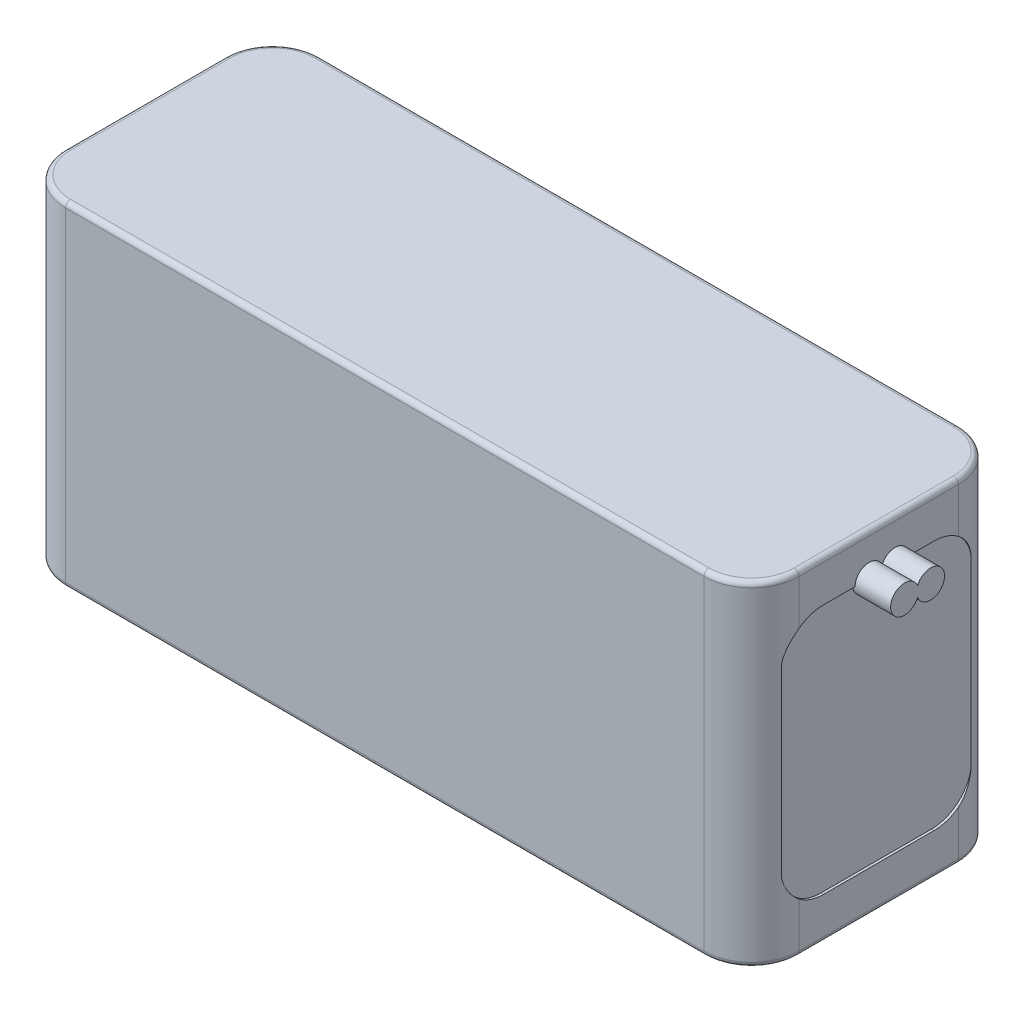
from build123d import *

# Parameters (mm, degrees)
SKETCH1_W                = 147
SKETCH1_H                = 67.000000112
BOSS_EXTRUDE1_DEPTH      = 51
CUT_EXTRUDE1_DEPTH       = 0.5
CUT_EXTRUDE2_DEPTH       = 0.5
FILLET1_R                = 9.525
FILLET2_R                = 1
BOSS_EXTRUDE2_DEPTH      = 7.62
BOSS_EXTRUDE2_DEPTH_BACK = 2.54


with BuildPart() as part:
    # Sketch1 → Boss-Extrude1 (new body)
    with BuildSketch(Plane(origin=(0, 0, -15), x_dir=(-1, 0, 0), z_dir=(0, 0, -1))):
        with Locations((4.5, 11.500000056)):
            Rectangle(SKETCH1_W, SKETCH1_H)
    extrude(amount=-BOSS_EXTRUDE1_DEPTH)

    # Sketch2 → Cut-Extrude1 (cut)
    with BuildSketch(Plane(origin=(69, 0, 0), x_dir=(0, 0, -1), z_dir=(1, 0, 0))):
        with BuildLine():
            Line((-29.625, 28.625000098), (-29.625, -5.624999986))
            ThreePointArc((-29.625, -5.624999986), (-27.281854249, -11.281854235), (-21.625, -13.624999986))
            Line((-21.625, -13.624999986), (0.625, -13.624999986))
            ThreePointArc((0.625, -13.624999986), (6.281854249, -11.281854235), (8.625, -5.624999986))
            Line((8.625, -5.624999986), (8.625, 28.625000098))
            ThreePointArc((8.625, 28.625000098), (6.281854249, 34.281854347), (0.625, 36.625000098))
            Line((0.625, 36.625000098), (-21.625, 36.625000098))
            ThreePointArc((-21.625, 36.625000098), (-27.281854249, 34.281854347), (-29.625, 28.625000098))
        make_face()
    extrude(amount=-CUT_EXTRUDE1_DEPTH, mode=Mode.SUBTRACT)

    # Sketch3 → Cut-Extrude2 (cut)
    with BuildSketch(Plane.ZY.offset(78)):
        with BuildLine():
            Line((18.195, 36.625000098), (2.805, 36.625000098))
            ThreePointArc((2.805, 36.625000098), (-5.277230509, 33.277230607), (-8.625, 25.195000098))
            Line((-8.625, 25.195000098), (-8.625, -2.194999986))
            ThreePointArc((-8.625, -2.194999986), (-5.277230509, -10.277230495), (2.805, -13.624999986))
            Line((2.805, -13.624999986), (18.195, -13.624999986))
            ThreePointArc((18.195, -13.624999986), (26.277230509, -10.277230495), (29.625, -2.194999986))
            Line((29.625, -2.194999986), (29.625, 25.195000098))
            ThreePointArc((29.625, 25.195000098), (26.277230509, 33.277230607), (18.195, 36.625000098))
        make_face()
    extrude(amount=-CUT_EXTRUDE2_DEPTH, mode=Mode.SUBTRACT)

    # Fillet1
    # the kernel refuses this fillet: 9.525 mm, written as the material it takes off along each edge
    with BuildSketch(Plane(origin=(-78, -45.8125, -15), x_dir=(0, 0, 1), z_dir=(0, 1, 0)), Plane(origin=(69, 68.812500112, -15), x_dir=(0, 0, 1), z_dir=(0, -1, 0))) as fillet1_piece_1:
        with BuildLine():
            CenterArc((FILLET1_R, FILLET1_R), FILLET1_R, 180, 90)
            Line((0, FILLET1_R), (0, 0))
            Line((0, 0), (FILLET1_R, 0))
        make_face()
    extrude(amount=114.625000112, mode=Mode.SUBTRACT)
    with BuildSketch(Plane(origin=(-78, -45.8125, 36), x_dir=(0, 0, -1), z_dir=(0, 1, 0)), Plane(origin=(69, 68.812500112, 36), x_dir=(0, 0, -1), z_dir=(0, -1, 0))) as fillet1_piece_2:
        with BuildLine():
            CenterArc((FILLET1_R, -FILLET1_R), FILLET1_R, 90, 90)
            Line((0, -FILLET1_R), (0, 0))
            Line((0, 0), (FILLET1_R, 0))
        make_face()
    extrude(amount=114.625000112, mode=Mode.SUBTRACT)

    # Fillet2
    fillet2_edges = [part.edges().sort_by_distance(p)[0] for p in [
        (-4.5, -22, -15),
        (-4.5, 45.000000112, -15),
        (-78, 45.000000112, 10.5),
        (-4.5, 45.000000112, 36),
        (69, 45.000000112, 10.5),
        (66.210192091, 45.000000112, 33.210192091),
        (66.210192091, 45.000000112, -12.210192091),
        (-75.210192091, 45.000000112, 33.210192091),
        (-75.210192091, 45.000000112, -12.210192091),
        (-78, -22, 10.5),
        (69, -22, 10.5),
        (-4.5, -22, 36),
        (66.210192091, -22, 33.210192091),
        (66.210192091, -22, -12.210192091),
        (-75.210192091, -22, 33.210192091),
        (-75.210192091, -22, -12.210192091),
    ]]
    fillet(fillet2_edges, radius=FILLET2_R)

    # Sketch5 → Boss-Extrude2 (add, two sides: drawn at the far end of the back side and taken through both)
    with BuildSketch(Plane(origin=(68.5, 0, 0), x_dir=(0, 0, -1), z_dir=(1, 0, 0)).offset(-BOSS_EXTRUDE2_DEPTH_BACK)):
        with BuildLine():
            Line((-10.019743612, 36.625000098), (-9.645122715, 36.625000098))
            ThreePointArc((-9.645122715, 36.625000098), (-9.692349462, 37.136539634), (-9.832433164, 37.63078615))
            ThreePointArc((-9.832433164, 37.63078615), (-9.972516865, 37.136539634), (-10.019743612, 36.625000098))
        make_face()
        with BuildLine():
            Line((-4.431743612, 36.625000098), (-9.645122715, 36.625000098))
            ThreePointArc((-9.645122715, 36.625000098), (-9.692349462, 36.113460562), (-9.832433164, 35.619214046))
            ThreePointArc((-9.832433164, 35.619214046), (-6.714204076, 33.878226845), (-4.431743612, 36.625000098))
        make_face()
        with BuildLine():
            ThreePointArc((-9.832433164, 37.63078615), (-9.692349462, 37.136539634), (-9.645122715, 36.625000098))
            Line((-9.645122715, 36.625000098), (-4.431743612, 36.625000098))
            ThreePointArc((-4.431743612, 36.625000098), (-6.714204076, 39.371773351), (-9.832433164, 37.63078615))
        make_face()
        with BuildLine():
            ThreePointArc((-9.832433164, 35.619214046), (-9.692349462, 36.113460562), (-9.645122715, 36.625000098))
            Line((-9.645122715, 36.625000098), (-10.019743612, 36.625000098))
            ThreePointArc((-10.019743612, 36.625000098), (-9.972516865, 36.113460562), (-9.832433164, 35.619214046))
        make_face()
        with BuildLine():
            ThreePointArc((-10.019743612, 36.625000098), (-9.972516865, 37.136539634), (-9.832433164, 37.63078615))
            ThreePointArc((-9.832433164, 37.63078615), (-12.950662251, 39.371773351), (-15.233122715, 36.625000098))
            Line((-15.233122715, 36.625000098), (-10.019743612, 36.625000098))
        make_face()
        with BuildLine():
            ThreePointArc((-15.233122715, 36.625000098), (-12.950662251, 33.878226845), (-9.832433164, 35.619214046))
            ThreePointArc((-9.832433164, 35.619214046), (-9.972516865, 36.113460562), (-10.019743612, 36.625000098))
            Line((-10.019743612, 36.625000098), (-15.233122715, 36.625000098))
        make_face()
    extrude(amount=BOSS_EXTRUDE2_DEPTH + BOSS_EXTRUDE2_DEPTH_BACK)


solid = part.part
